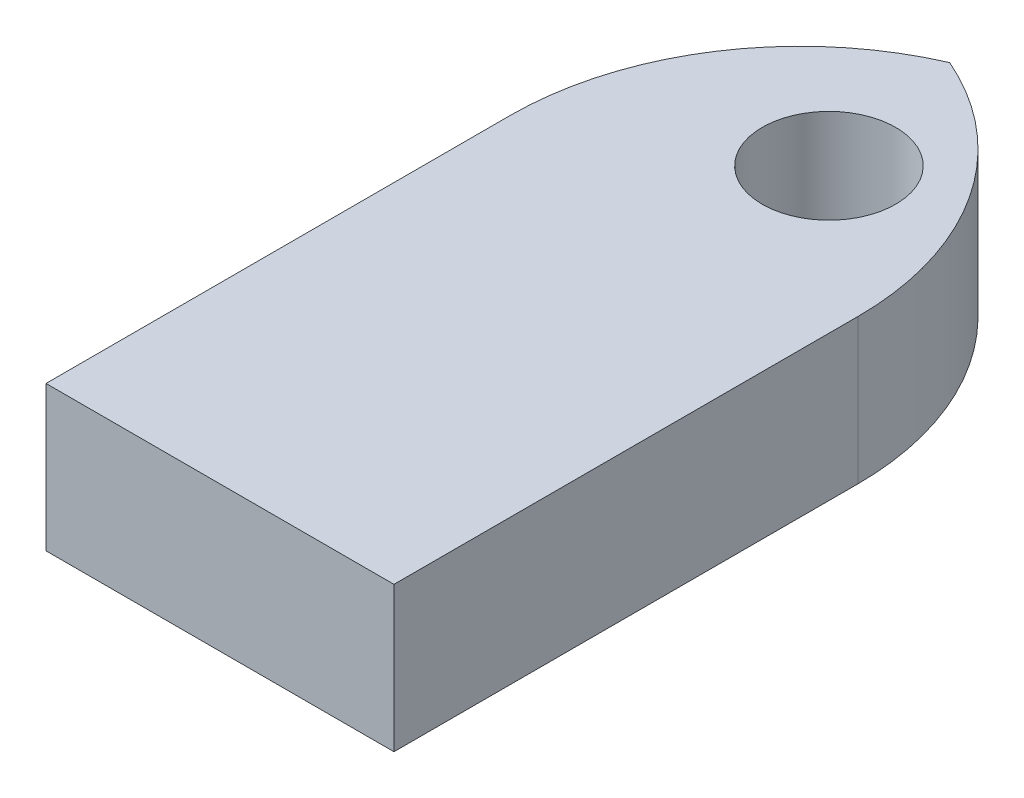
from build123d import *

# Parameters (mm, degrees)
SKETCH1_W           = 7.62
SKETCH1_H           = 16.51
SKETCH1_R           = 1.4605
BOSS_EXTRUDE1_DEPTH = 3.175
FILLET3_R           = 6.35


with BuildPart() as part:
    # Sketch1 → Boss-Extrude1 (new body)
    with BuildSketch(Plane(origin=(0, 0, 0), x_dir=(1, 0, 0), z_dir=(0, 1, 0))):
        with Locations((3.81, 8.255)):
            Rectangle(SKETCH1_W, SKETCH1_H)
        with Locations(Location((4.445, 12.7, 0), (0, 0, 270))):
            Circle(SKETCH1_R, mode=Mode.SUBTRACT)
    extrude(amount=BOSS_EXTRUDE1_DEPTH)

    # Fillet3
    # the kernel refuses this fillet: 6.35 mm, written as the material it takes off along each edge
    with BuildSketch(Plane(origin=(0, -15.875, -16.51), x_dir=(1, 0, 0), z_dir=(0, 1, 0)), Plane(origin=(7.62, -15.875, -16.51), x_dir=(0, 0, 1), z_dir=(0, 1, 0))) as fillet3_piece_1:
        with BuildLine():
            CenterArc((FILLET3_R, -FILLET3_R), FILLET3_R, 90, 90)
            Line((0, -FILLET3_R), (0, 0))
            Line((0, 0), (FILLET3_R, 0))
        make_face()
    extrude(amount=34.925, mode=Mode.SUBTRACT)


solid = part.part
